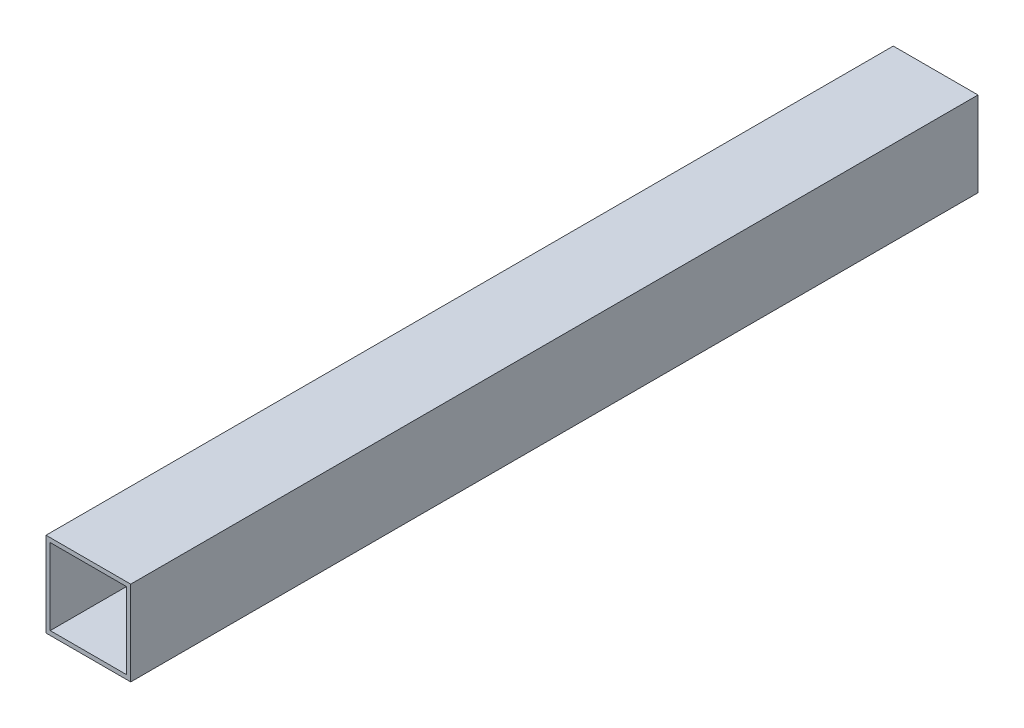
from build123d import *

# Parameters (mm, degrees)
SKETCH1_W           = 50
SKETCH1_H           = 50
SKETCH1_W_2         = 45
SKETCH1_H_2         = 45
BOSS_EXTRUDE1_DEPTH = 250


with BuildPart() as part:
    # Sketch1 → Boss-Extrude1 (new, symmetric)
    with BuildSketch(Plane.XY):
        Rectangle(SKETCH1_W, SKETCH1_H)
        Rectangle(SKETCH1_W_2, SKETCH1_H_2, mode=Mode.SUBTRACT)
    extrude(amount=BOSS_EXTRUDE1_DEPTH, both=True)


solid = part.part
